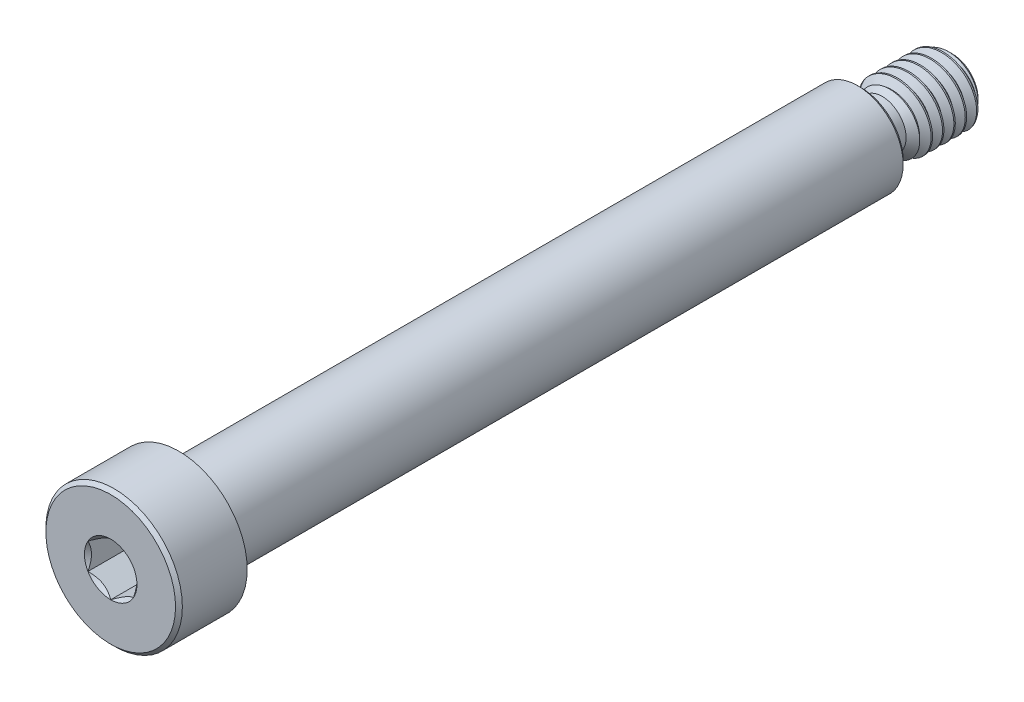
from build123d import *

# Parameters (mm, degrees)
CUT_EXTRUDE1_DEPTH = 2.25
FILLET1_R          = 0.05
CUT_SWEEP1_PITCH   = 0.5


with BuildPart() as part:
    # Sketch4 → Revolve1 (revolve)
    with BuildSketch(Plane(origin=(0, 0, 0), x_dir=(0, 0, -1), z_dir=(1, 0, 0)), mode=Mode.PRIVATE) as revolve1_sk:
        Polygon((-15.5, 3), (-18.35, 3), (-18.5, 2.85), (-18.5, 0), (14.5, 0), (14.5, 1.833333333), (14.333333333, 2), (-15.5, 2), align=None)
    revolve(revolve1_sk.sketch.rotate(Axis((0, 0, 18.5), (0, 0, -1)), 90), axis=Axis((0, 0, 18.5), (0, 0, -1)))

    # Sketch5 → Cut-Extrude1 (cut)
    with BuildSketch(Plane.XY.offset(18.5)):
        Polygon((1, 0.577350269), (0, 1.154700538), (-1, 0.577350269), (-1, -0.577350269), (0, -1.154700538), (1, -0.577350269), align=None)
    extrude(amount=-CUT_EXTRUDE1_DEPTH, mode=Mode.SUBTRACT)

    # Cut-Extrude4 cone 1 section (through the dimple's axis) → Cut-Extrude4 (revolve, cut)
    with BuildSketch(Plane(origin=(0, 0, 18.5), x_dir=(0, -1, 0), z_dir=(1, 0, 0))):
        Polygon((0, 0), (1.154700538, 0), (0, 1.154700538), align=None)
    revolve(axis=Axis((0, 0, 18.5), (0, 0, -1)), mode=Mode.SUBTRACT)

    # Sketch7 → Revolve2 (revolve)
    with BuildSketch(Plane(origin=(0, 0, 0), x_dir=(0, 0, -1), z_dir=(1, 0, 0)), mode=Mode.PRIVATE) as revolve2_sk:
        Polygon((14.5, 1.5), (18.125, 1.5), (18.5, 1.125), (18.5, 0), (14.5, 0), align=None)
    revolve(revolve2_sk.sketch.rotate(Axis((0, 0, -18.5), (0, 0, 1)), 90), axis=Axis((0, 0, -18.5), (0, 0, 1)))

    # Sketch10 → Cut-Revolve1 (revolve, cut)
    with BuildSketch(Plane(origin=(0, 0, 0), x_dir=(0, 0, -1), z_dir=(1, 0, 0)), mode=Mode.PRIVATE) as cut_revolve1_sk:
        with BuildLine():
            Line((14.725, 1.05), (15.414, 1.05))
            Line((15.414, 1.05), (16.364, 2))
            Line((16.364, 2), (14.5, 2))
            Line((14.5, 2), (14.5, 1.275))
            ThreePointArc((14.5, 1.275), (14.565900974, 1.115900974), (14.725, 1.05))
        make_face()
        Polygon((-15.5, 2), (-15.1, 2), (-15.2, 1.9), (-15.5, 1.9), align=None)
    revolve(cut_revolve1_sk.sketch.rotate(Axis((0, 0, -18.5), (0, 0, 1)), 90), axis=Axis((0, 0, -18.5), (0, 0, 1)), mode=Mode.SUBTRACT)

    # Fillet1
    fillet1_edges = [part.edges().sort_by_distance(p)[0] for p in [
        (1.9, 0, 15.5),
    ]]
    fillet(fillet1_edges, radius=FILLET1_R)

    # Cut-Sweep1: the profile of Sketch9 screwed along a right-hand helix of 7.172 turns, 6 arcs to a turn; built about Z, then put on its axis
    cut_sweep1_z = Axis((0, 0, 0), (0, 0, 1))
    cut_sweep1_corners = [(1.175240474, 0, -0.1875), (1.175240474, 0, -0.25), (1.527063294, 0, -0.453125), (1.527063294, 0, 0.015625)]
    with BuildLine(mode=Mode.PRIVATE) as cut_sweep1_profile:
        Line(cut_sweep1_corners[0], cut_sweep1_corners[1])
        Line(cut_sweep1_corners[1], cut_sweep1_corners[2])
        Line(cut_sweep1_corners[2], cut_sweep1_corners[3])
        Line(cut_sweep1_corners[3], cut_sweep1_corners[0])
    cut_sweep1_cap = Face(cut_sweep1_profile.wire())
    cut_sweep1_turn_angles = [0, 30, 60, 90, 120, 150, 180, 210, 240, 270, 300, 330, 360]
    cut_sweep1_turn_weights = [1, 0.8660254037844387, 1, 0.8660254037844387, 1, 0.8660254037844387, 1, 0.8660254037844387, 1, 0.8660254037844387, 1, 0.8660254037844387, 1]
    cut_sweep1_turn_rails = [Edge.make_bspline([Vector(p[0], p[1], 0).rotate(cut_sweep1_z, cut_sweep1_turn_angles[k]) / cut_sweep1_turn_weights[k] + Vector(0, 0, p[2] + CUT_SWEEP1_PITCH * cut_sweep1_turn_angles[k] / 360) for k in range(13)], [0, 0, 0, 1, 1, 2, 2, 3, 3, 4, 4, 5, 5, 6, 6, 6], 2, cut_sweep1_turn_weights) for p in cut_sweep1_corners]
    cut_sweep1_turn_sides = [Face.make_surface_from_curves(cut_sweep1_turn_rails[p[0]], cut_sweep1_turn_rails[p[1]]) for p in [(0, 1), (1, 2), (2, 3), (3, 0)]]
    cut_sweep1_last_angles = [2520, 2550, 2580, 2580.96, 2581.92]
    cut_sweep1_last_weights = [1, 0.8660254037844387, 1, 0.9998596355767793, 1]
    cut_sweep1_last_rails = [Edge.make_bspline([Vector(p[0], p[1], 0).rotate(cut_sweep1_z, cut_sweep1_last_angles[k]) / cut_sweep1_last_weights[k] + Vector(0, 0, p[2] + CUT_SWEEP1_PITCH * cut_sweep1_last_angles[k] / 360) for k in range(5)], [0, 0, 0, 1, 1, 2, 2, 2], 2, cut_sweep1_last_weights) for p in cut_sweep1_corners]
    cut_sweep1_last_sides = [Face.make_surface_from_curves(cut_sweep1_last_rails[p[0]], cut_sweep1_last_rails[p[1]]) for p in [(0, 1), (1, 2), (2, 3), (3, 0)]]
    cut_sweep1 = Plane(origin=(0, 0, -18.5), x_dir=(0, 1, 0), z_dir=(0, 0, 1)) * Solid(Shell([*[p.moved(Location((0, 0, CUT_SWEEP1_PITCH * i))) for i in range(7) for p in cut_sweep1_turn_sides], *cut_sweep1_last_sides, cut_sweep1_cap, cut_sweep1_cap.rotate(cut_sweep1_z, 2581.92).moved(Location((0, 0, CUT_SWEEP1_PITCH * 2581.92 / 360)))]))
    add(cut_sweep1, mode=Mode.SUBTRACT)


solid = part.part
